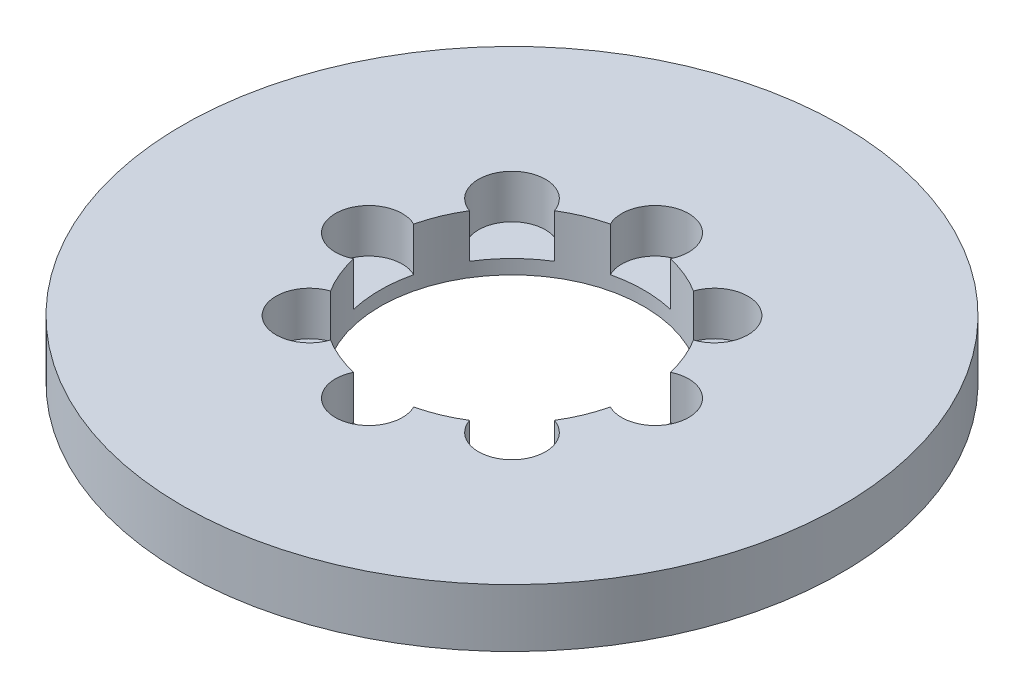
from build123d import *

# Parameters (mm, degrees)
SKETCH1_R           = 62.5
BOSS_EXTRUDE1_DEPTH = 11
SKETCH2_R           = 25
CUT_EXTRUDE1_DEPTH  = 90.070197036
SKETCH3_R           = 6.351667653
CUT_EXTRUDE2_DEPTH  = 8.304289905
CIRPATTERN1_COUNT   = 8


with BuildPart() as part:
    # Sketch1 → Boss-Extrude1 (new body)
    with BuildSketch(Plane(origin=(0, 0, 0), x_dir=(1, 0, 0), z_dir=(0, 1, 0))):
        Circle(SKETCH1_R)
    extrude(amount=BOSS_EXTRUDE1_DEPTH)

    # Sketch2 → Cut-Extrude1 (cut, through all)
    with BuildSketch(Plane(origin=(0, 0, 0), x_dir=(1, 0, 0), z_dir=(0, 1, 0))):
        Circle(SKETCH2_R)
    extrude(amount=CUT_EXTRUDE1_DEPTH, mode=Mode.SUBTRACT)

    # Sketch3 → Cut-Extrude2 (cut)
    with BuildSketch(Plane(origin=(0, 11, 0), x_dir=(1, 0, 0), z_dir=(0, 1, 0))):
        with Locations((-27.156397015, 0)):
            Circle(SKETCH3_R)
    cut_extrude2 = extrude(amount=-CUT_EXTRUDE2_DEPTH, mode=Mode.SUBTRACT)

    # CirPattern1: Cut-Extrude2 ×8 about axis
    cirpattern1_axis = Axis((0, 0, 0), (0, 1, 0))
    for i in range(1, CIRPATTERN1_COUNT):
        add(cut_extrude2.rotate(cirpattern1_axis, i * 360 / CIRPATTERN1_COUNT), mode=Mode.SUBTRACT)


solid = part.part
